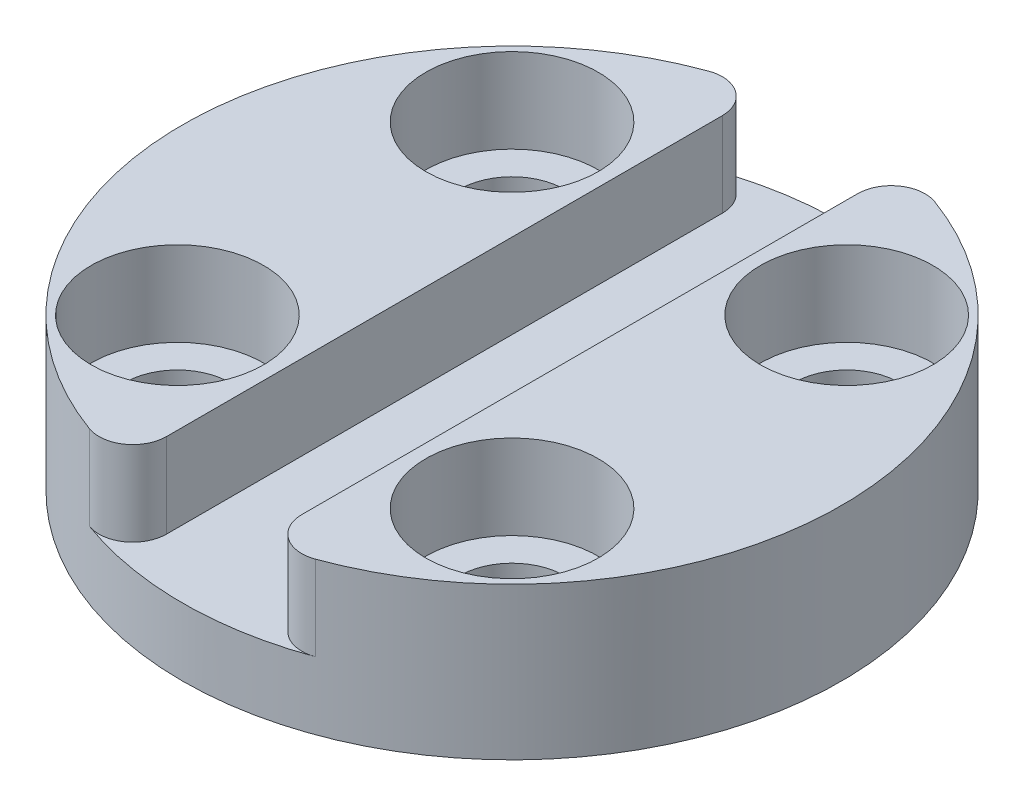
from build123d import *
from build123d.topology import SkipClean

# Parameters (mm, degrees)
SKETCH_1_R      = 9.75
SKETCH_1_R_2    = 1.55
EXTRUDE_1_DEPTH = 2
SKETCH_2_R      = 2.55
EXTRUDE_2_DEPTH = 2.5


with BuildPart() as part:
    # 草图1 → 凸台-拉伸1 (new body)
    with BuildSketch(Plane(origin=(0, 0, 0), x_dir=(1, 0, 0), z_dir=(0, 1, 0))):
        Circle(SKETCH_1_R)
        with Locations((4.949747468, 4.949747468)):
            Circle(SKETCH_1_R_2, mode=Mode.SUBTRACT)
        with Locations((4.949747468, -4.949747468)):
            Circle(SKETCH_1_R_2, mode=Mode.SUBTRACT)
        with Locations((-4.949747468, -4.949747468)):
            Circle(SKETCH_1_R_2, mode=Mode.SUBTRACT)
        with Locations((-4.949747468, 4.949747468)):
            Circle(SKETCH_1_R_2, mode=Mode.SUBTRACT)
    extrude(amount=EXTRUDE_1_DEPTH)

    # 草图2 → 凸台-拉伸2 (add)
    # profile 1 of 2: a face of its own
    with SkipClean():  # the faces are left unmerged after this step: merging them gives an invalid solid
        with BuildSketch(Plane(origin=(0, 2, 0), x_dir=(1, 0, 0), z_dir=(0, 1, 0))):
            with BuildLine():
                Line((-2, 8.219641111), (-2, -8.219641111))
                ThreePointArc((-2, -8.219641111), (-2.426788496, -9.039048563), (-3.342857143, -9.159028667))
                ThreePointArc((-3.342857143, -9.159028667), (-9.75, 0), (-3.342857143, 9.159028667))
                ThreePointArc((-3.342857143, 9.159028667), (-2.426788496, 9.039048563), (-2, 8.219641111))
            make_face()
            with Locations((-4.949747468, 4.949747468)):
                Circle(SKETCH_2_R, mode=Mode.SUBTRACT)
            with Locations((-4.949747468, -4.949747468)):
                Circle(SKETCH_2_R, mode=Mode.SUBTRACT)
        # profile 2 of 2: a face of its own
        with BuildSketch(Plane(origin=(0, 2, 0), x_dir=(1, 0, 0), z_dir=(0, 1, 0))):
            with BuildLine():
                Line((2, 8.219641111), (2, -8.219641111))
                ThreePointArc((2, -8.219641111), (2.426788496, -9.039048563), (3.342857143, -9.159028667))
                ThreePointArc((3.342857143, -9.159028667), (9.75, 0), (3.342857143, 9.159028667))
                ThreePointArc((3.342857143, 9.159028667), (2.426788496, 9.039048563), (2, 8.219641111))
            make_face()
            with Locations((4.949747468, 4.949747468)):
                Circle(SKETCH_2_R, mode=Mode.SUBTRACT)
            with Locations((4.949747468, -4.949747468)):
                Circle(SKETCH_2_R, mode=Mode.SUBTRACT)
        extrude(amount=EXTRUDE_2_DEPTH)


solid = part.part
